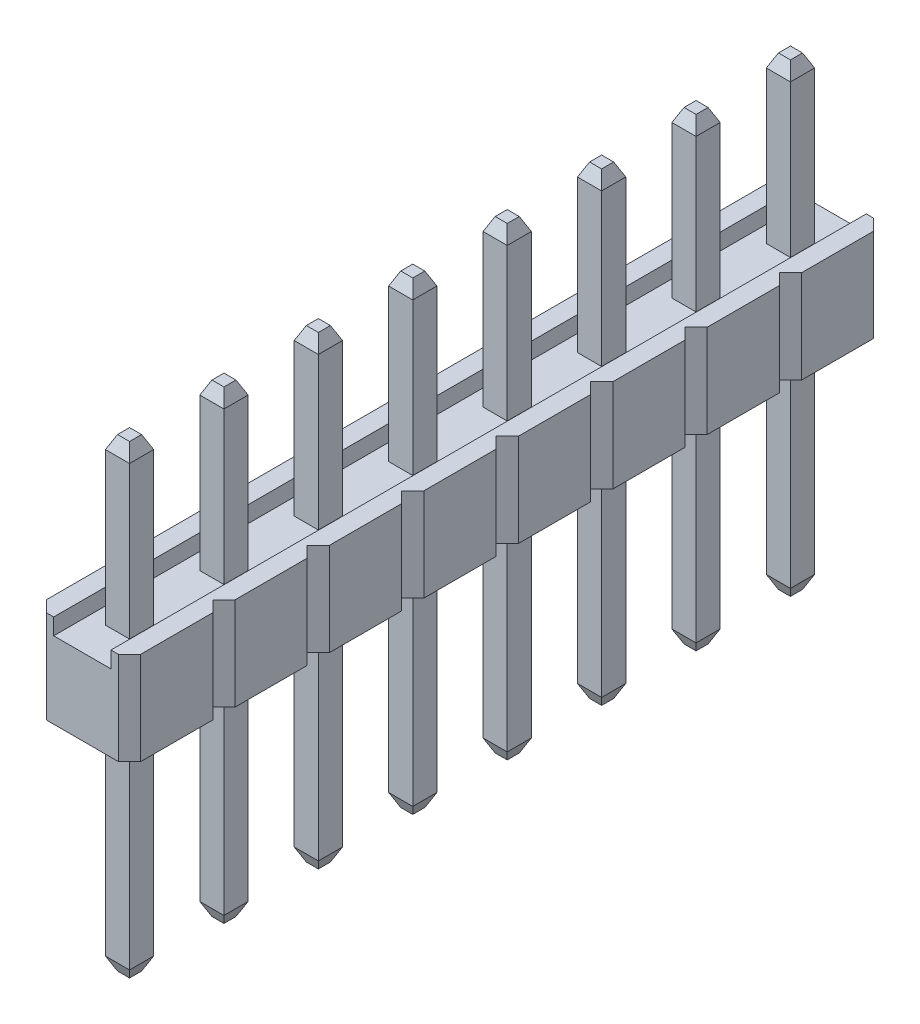
from build123d import *
from OCP.BRepFilletAPI import BRepFilletAPI_MakeChamfer

# Parameters (mm, degrees)
EXTRUDE1_DEPTH                   = 2.5
SKETCH2_W                        = 1.54
SKETCH2_H                        = 0.508742985
CUT_EXTRUDE1_DEPTH               = 12.5
SKETCH3_W                        = 0.65
SKETCH3_H                        = 0.65
EXTRUDE2_DEPTH                   = 4.44
CHAMFER1_SIZE                    = 0.35
CHAMFER1_SIZE2                   = 0.16320768
SKETCH4_W                        = 0.65
SKETCH4_H                        = 0.65
EXTRUDE3_DEPTH                   = 6
CHAMFER2_SIZE                    = 0.35
CHAMFER2_SIZE2                   = 0.16320768
PADR_O_LINEAR1_DEPTH             = 2.06
PADR_O_START                     = 2.06
PADR_O_LINEAR1_2_DEPTH           = 0.44
PADR_O_LINEAR2_COUNT             = 8
PADR_O_LINEAR2_PITCH             = 2.54
CHAMFER1_OF_PADR_O_LINEAR2_SIZE  = 0.35
CHAMFER1_OF_PADR_O_LINEAR2_SIZE2 = 0.16320768
CHAMFER2_OF_PADR_O_LINEAR2_SIZE  = 0.35
CHAMFER2_OF_PADR_O_LINEAR2_SIZE2 = 0.16320768


# Read off the part's stored shape, not the designer's step: Padrão linear1
with BuildPart() as part:
    # Sketch1 → Extrude1 (new body)
    with BuildSketch(Plane(origin=(0, 0, 0), x_dir=(1, 0, 0), z_dir=(0, 1, 0))):
        Polygon((-0.97, 1.27), (0.97, 1.27), (1.27, 0.97), (1.27, -0.97), (0.97, -1.27), (-0.97, -1.27), (-1.27, -0.97), (-1.27, 0.97), align=None)
    extrude(amount=EXTRUDE1_DEPTH)

    # Sketch2 → Cut-Extrude1 (cut)
    with BuildSketch(Plane.XY.offset(1.27)):
        with Locations((0, 2.314371493)):
            Rectangle(SKETCH2_W, SKETCH2_H)
    extrude(amount=-CUT_EXTRUDE1_DEPTH, mode=Mode.SUBTRACT)

    # Sketch3 → Extrude2 (add)
    with BuildSketch(Plane(origin=(0, 2.06, 0), x_dir=(-1, 0, 0), z_dir=(0, 1, 0))):
        Rectangle(SKETCH3_W, SKETCH3_H)
    extrude2 = extrude(amount=EXTRUDE2_DEPTH)

    # Chamfer1: one chamfer whose edges measure the first distance from different faces: ONE call of the kernel's chamfer builder (chamfer() names one face for all edges)
    chamfer1_edges_1 = [part.edges().sort_by_distance(p)[0] for p in [
        (-0.325, 6.5, 0),
    ]]
    chamfer1_side_1 = [part.faces().sort_by_distance(p)[0] for p in [
        (-0.325, 4.28, 0),
    ]]
    chamfer1_edges_2 = [part.edges().sort_by_distance(p)[0] for p in [
        (0, 6.5, 0.325),
    ]]
    chamfer1_side_2 = [part.faces().sort_by_distance(p)[0] for p in [
        (0, 4.28, 0.325),
    ]]
    chamfer1_edges_3 = [part.edges().sort_by_distance(p)[0] for p in [
        (0.325, 6.5, 0),
    ]]
    chamfer1_side_3 = [part.faces().sort_by_distance(p)[0] for p in [
        (0.325, 4.28, 0),
    ]]
    chamfer1_edges_4 = [part.edges().sort_by_distance(p)[0] for p in [
        (0, 6.5, -0.325),
    ]]
    chamfer1_side_4 = [part.faces().sort_by_distance(p)[0] for p in [
        (0, 4.28, -0.325),
    ]]
    chamfer1 = BRepFilletAPI_MakeChamfer(part.part.solid().wrapped)
    for e in chamfer1_edges_1:
        chamfer1.Add(CHAMFER1_SIZE, CHAMFER1_SIZE2, e.wrapped, chamfer1_side_1[0].wrapped)  # the first distance lies on this face
    for e in chamfer1_edges_2:
        chamfer1.Add(CHAMFER1_SIZE, CHAMFER1_SIZE2, e.wrapped, chamfer1_side_2[0].wrapped)  # the first distance lies on this face
    for e in chamfer1_edges_3:
        chamfer1.Add(CHAMFER1_SIZE, CHAMFER1_SIZE2, e.wrapped, chamfer1_side_3[0].wrapped)  # the first distance lies on this face
    for e in chamfer1_edges_4:
        chamfer1.Add(CHAMFER1_SIZE, CHAMFER1_SIZE2, e.wrapped, chamfer1_side_4[0].wrapped)  # the first distance lies on this face
    add(Compound.cast(chamfer1.Shape()), mode=Mode.REPLACE)

    # Sketch4 → Extrude3 (add)
    with BuildSketch(Plane.XZ):
        Rectangle(SKETCH4_W, SKETCH4_H)
    extrude3 = extrude(amount=EXTRUDE3_DEPTH)

    # Chamfer2: one chamfer whose edges measure the first distance from different faces: ONE call of the kernel's chamfer builder (chamfer() names one face for all edges)
    chamfer2_edges_1 = [part.edges().sort_by_distance(p)[0] for p in [
        (-0.325, -6, 0),
    ]]
    chamfer2_side_1 = [part.faces().sort_by_distance(p)[0] for p in [
        (-0.325, -3, 0),
    ]]
    chamfer2_edges_2 = [part.edges().sort_by_distance(p)[0] for p in [
        (0, -6, -0.325),
    ]]
    chamfer2_side_2 = [part.faces().sort_by_distance(p)[0] for p in [
        (0, -3, -0.325),
    ]]
    chamfer2_edges_3 = [part.edges().sort_by_distance(p)[0] for p in [
        (0.325, -6, 0),
    ]]
    chamfer2_side_3 = [part.faces().sort_by_distance(p)[0] for p in [
        (0.325, -3, 0),
    ]]
    chamfer2_edges_4 = [part.edges().sort_by_distance(p)[0] for p in [
        (0, -6, 0.325),
    ]]
    chamfer2_side_4 = [part.faces().sort_by_distance(p)[0] for p in [
        (0, -3, 0.325),
    ]]
    chamfer2 = BRepFilletAPI_MakeChamfer(part.part.solid().wrapped)
    for e in chamfer2_edges_1:
        chamfer2.Add(CHAMFER2_SIZE, CHAMFER2_SIZE2, e.wrapped, chamfer2_side_1[0].wrapped)  # the first distance lies on this face
    for e in chamfer2_edges_2:
        chamfer2.Add(CHAMFER2_SIZE, CHAMFER2_SIZE2, e.wrapped, chamfer2_side_2[0].wrapped)  # the first distance lies on this face
    for e in chamfer2_edges_3:
        chamfer2.Add(CHAMFER2_SIZE, CHAMFER2_SIZE2, e.wrapped, chamfer2_side_3[0].wrapped)  # the first distance lies on this face
    for e in chamfer2_edges_4:
        chamfer2.Add(CHAMFER2_SIZE, CHAMFER2_SIZE2, e.wrapped, chamfer2_side_4[0].wrapped)  # the first distance lies on this face
    add(Compound.cast(chamfer2.Shape()), mode=Mode.REPLACE)

    # Padrão linear1 outline → Padrão linear1 (add)
    with BuildSketch(Plane(origin=(0, 0, 0), x_dir=(1, 0, 0), z_dir=(0, 1, 0))):
        Polygon((-1.27, 3.51), (-1.27, 1.57), (-0.97, 1.27), (0.97, 1.27), (1.27, 1.57), (1.27, 3.51), (0.97, 3.81), (1.27, 4.11), (1.27, 6.05), (0.97, 6.35), (1.27, 6.65), (1.27, 8.59), (0.97, 8.89), (1.27, 9.19), (1.27, 11.13), (0.97, 11.43), (1.27, 11.73), (1.27, 13.67), (0.97, 13.97), (1.27, 14.27), (1.27, 16.21), (0.97, 16.51), (1.27, 16.81), (1.27, 18.75), (0.97, 19.05), (-0.97, 19.05), (-1.27, 18.75), (-1.27, 16.81), (-0.97, 16.51), (-1.27, 16.21), (-1.27, 14.27), (-0.97, 13.97), (-1.27, 13.67), (-1.27, 11.73), (-0.97, 11.43), (-1.27, 11.13), (-1.27, 9.19), (-0.97, 8.89), (-1.27, 8.59), (-1.27, 6.65), (-0.97, 6.35), (-1.27, 6.05), (-1.27, 4.11), (-0.97, 3.81), align=None)
    extrude(amount=PADR_O_LINEAR1_DEPTH)

    # Padr_o linear1 2 outline → Padr_o linear1 2 (add)
    with BuildSketch(Plane(origin=(0, 0, 0), x_dir=(1, 0, 0), z_dir=(0, 1, 0)).offset(PADR_O_START)):
        Polygon((-1.27, 3.51), (-1.27, 1.57), (-0.97, 1.27), (-0.77, 1.27), (-0.77, 19.05), (-0.97, 19.05), (-1.27, 18.75), (-1.27, 16.81), (-0.97, 16.51), (-1.27, 16.21), (-1.27, 14.27), (-0.97, 13.97), (-1.27, 13.67), (-1.27, 11.73), (-0.97, 11.43), (-1.27, 11.13), (-1.27, 9.19), (-0.97, 8.89), (-1.27, 8.59), (-1.27, 6.65), (-0.97, 6.35), (-1.27, 6.05), (-1.27, 4.11), (-0.97, 3.81), align=None)
        Polygon((0.77, 19.05), (0.77, 1.27), (0.97, 1.27), (1.27, 1.57), (1.27, 3.51), (0.97, 3.81), (1.27, 4.11), (1.27, 6.05), (0.97, 6.35), (1.27, 6.65), (1.27, 8.59), (0.97, 8.89), (1.27, 9.19), (1.27, 11.13), (0.97, 11.43), (1.27, 11.73), (1.27, 13.67), (0.97, 13.97), (1.27, 14.27), (1.27, 16.21), (0.97, 16.51), (1.27, 16.81), (1.27, 18.75), (0.97, 19.05), align=None)
    extrude(amount=PADR_O_LINEAR1_2_DEPTH)

    # Padrão linear2: Extrude2, Extrude3 ×8
    with Locations(*[(0, 0, -i * PADR_O_LINEAR2_PITCH) for i in range(1, PADR_O_LINEAR2_COUNT)]):
        add(extrude2)
        add(extrude3)

    # Chamfer1 of Padrão linear2: one chamfer whose edges measure the first distance from different faces: ONE call of the kernel's chamfer builder (chamfer() names one face for all edges)
    chamfer1_of_padr_o_linear2_edges_1 = [part.edges().sort_by_distance(p)[0] for p in [
        (-0.325, 6.5, -2.54),
    ]]
    chamfer1_of_padr_o_linear2_side_1 = [part.faces().sort_by_distance(p)[0] for p in [
        (-0.325, 4.28, -2.54),
    ]]
    chamfer1_of_padr_o_linear2_edges_2 = [part.edges().sort_by_distance(p)[0] for p in [
        (0, 6.5, -2.215),
    ]]
    chamfer1_of_padr_o_linear2_side_2 = [part.faces().sort_by_distance(p)[0] for p in [
        (0, 4.28, -2.215),
    ]]
    chamfer1_of_padr_o_linear2_edges_3 = [part.edges().sort_by_distance(p)[0] for p in [
        (0.325, 6.5, -2.54),
    ]]
    chamfer1_of_padr_o_linear2_side_3 = [part.faces().sort_by_distance(p)[0] for p in [
        (0.325, 4.28, -2.54),
    ]]
    chamfer1_of_padr_o_linear2_edges_4 = [part.edges().sort_by_distance(p)[0] for p in [
        (0, 6.5, -2.865),
    ]]
    chamfer1_of_padr_o_linear2_side_4 = [part.faces().sort_by_distance(p)[0] for p in [
        (0, 4.28, -2.865),
    ]]
    chamfer1_of_padr_o_linear2_edges_5 = [part.edges().sort_by_distance(p)[0] for p in [
        (-0.325, 6.5, -5.08),
    ]]
    chamfer1_of_padr_o_linear2_side_5 = [part.faces().sort_by_distance(p)[0] for p in [
        (-0.325, 4.28, -5.08),
    ]]
    chamfer1_of_padr_o_linear2_edges_6 = [part.edges().sort_by_distance(p)[0] for p in [
        (0, 6.5, -4.755),
    ]]
    chamfer1_of_padr_o_linear2_side_6 = [part.faces().sort_by_distance(p)[0] for p in [
        (0, 4.28, -4.755),
    ]]
    chamfer1_of_padr_o_linear2_edges_7 = [part.edges().sort_by_distance(p)[0] for p in [
        (0.325, 6.5, -5.08),
    ]]
    chamfer1_of_padr_o_linear2_side_7 = [part.faces().sort_by_distance(p)[0] for p in [
        (0.325, 4.28, -5.08),
    ]]
    chamfer1_of_padr_o_linear2_edges_8 = [part.edges().sort_by_distance(p)[0] for p in [
        (0, 6.5, -5.405),
    ]]
    chamfer1_of_padr_o_linear2_side_8 = [part.faces().sort_by_distance(p)[0] for p in [
        (0, 4.28, -5.405),
    ]]
    chamfer1_of_padr_o_linear2_edges_9 = [part.edges().sort_by_distance(p)[0] for p in [
        (-0.325, 6.5, -7.62),
    ]]
    chamfer1_of_padr_o_linear2_side_9 = [part.faces().sort_by_distance(p)[0] for p in [
        (-0.325, 4.28, -7.62),
    ]]
    chamfer1_of_padr_o_linear2_edges_10 = [part.edges().sort_by_distance(p)[0] for p in [
        (0, 6.5, -7.295),
    ]]
    chamfer1_of_padr_o_linear2_side_10 = [part.faces().sort_by_distance(p)[0] for p in [
        (0, 4.28, -7.295),
    ]]
    chamfer1_of_padr_o_linear2_edges_11 = [part.edges().sort_by_distance(p)[0] for p in [
        (0.325, 6.5, -7.62),
    ]]
    chamfer1_of_padr_o_linear2_side_11 = [part.faces().sort_by_distance(p)[0] for p in [
        (0.325, 4.28, -7.62),
    ]]
    chamfer1_of_padr_o_linear2_edges_12 = [part.edges().sort_by_distance(p)[0] for p in [
        (0, 6.5, -7.945),
    ]]
    chamfer1_of_padr_o_linear2_side_12 = [part.faces().sort_by_distance(p)[0] for p in [
        (0, 4.28, -7.945),
    ]]
    chamfer1_of_padr_o_linear2_edges_13 = [part.edges().sort_by_distance(p)[0] for p in [
        (-0.325, 6.5, -10.16),
    ]]
    chamfer1_of_padr_o_linear2_side_13 = [part.faces().sort_by_distance(p)[0] for p in [
        (-0.325, 4.28, -10.16),
    ]]
    chamfer1_of_padr_o_linear2_edges_14 = [part.edges().sort_by_distance(p)[0] for p in [
        (0, 6.5, -9.835),
    ]]
    chamfer1_of_padr_o_linear2_side_14 = [part.faces().sort_by_distance(p)[0] for p in [
        (0, 4.28, -9.835),
    ]]
    chamfer1_of_padr_o_linear2_edges_15 = [part.edges().sort_by_distance(p)[0] for p in [
        (0.325, 6.5, -10.16),
    ]]
    chamfer1_of_padr_o_linear2_side_15 = [part.faces().sort_by_distance(p)[0] for p in [
        (0.325, 4.28, -10.16),
    ]]
    chamfer1_of_padr_o_linear2_edges_16 = [part.edges().sort_by_distance(p)[0] for p in [
        (0, 6.5, -10.485),
    ]]
    chamfer1_of_padr_o_linear2_side_16 = [part.faces().sort_by_distance(p)[0] for p in [
        (0, 4.28, -10.485),
    ]]
    chamfer1_of_padr_o_linear2_edges_17 = [part.edges().sort_by_distance(p)[0] for p in [
        (-0.325, 6.5, -12.7),
    ]]
    chamfer1_of_padr_o_linear2_side_17 = [part.faces().sort_by_distance(p)[0] for p in [
        (-0.325, 4.28, -12.7),
    ]]
    chamfer1_of_padr_o_linear2_edges_18 = [part.edges().sort_by_distance(p)[0] for p in [
        (0, 6.5, -12.375),
    ]]
    chamfer1_of_padr_o_linear2_side_18 = [part.faces().sort_by_distance(p)[0] for p in [
        (0, 4.28, -12.375),
    ]]
    chamfer1_of_padr_o_linear2_edges_19 = [part.edges().sort_by_distance(p)[0] for p in [
        (0.325, 6.5, -12.7),
    ]]
    chamfer1_of_padr_o_linear2_side_19 = [part.faces().sort_by_distance(p)[0] for p in [
        (0.325, 4.28, -12.7),
    ]]
    chamfer1_of_padr_o_linear2_edges_20 = [part.edges().sort_by_distance(p)[0] for p in [
        (0, 6.5, -13.025),
    ]]
    chamfer1_of_padr_o_linear2_side_20 = [part.faces().sort_by_distance(p)[0] for p in [
        (0, 4.28, -13.025),
    ]]
    chamfer1_of_padr_o_linear2_edges_21 = [part.edges().sort_by_distance(p)[0] for p in [
        (-0.325, 6.5, -15.24),
    ]]
    chamfer1_of_padr_o_linear2_side_21 = [part.faces().sort_by_distance(p)[0] for p in [
        (-0.325, 4.28, -15.24),
    ]]
    chamfer1_of_padr_o_linear2_edges_22 = [part.edges().sort_by_distance(p)[0] for p in [
        (0, 6.5, -14.915),
    ]]
    chamfer1_of_padr_o_linear2_side_22 = [part.faces().sort_by_distance(p)[0] for p in [
        (0, 4.28, -14.915),
    ]]
    chamfer1_of_padr_o_linear2_edges_23 = [part.edges().sort_by_distance(p)[0] for p in [
        (0.325, 6.5, -15.24),
    ]]
    chamfer1_of_padr_o_linear2_side_23 = [part.faces().sort_by_distance(p)[0] for p in [
        (0.325, 4.28, -15.24),
    ]]
    chamfer1_of_padr_o_linear2_edges_24 = [part.edges().sort_by_distance(p)[0] for p in [
        (0, 6.5, -15.565),
    ]]
    chamfer1_of_padr_o_linear2_side_24 = [part.faces().sort_by_distance(p)[0] for p in [
        (0, 4.28, -15.565),
    ]]
    chamfer1_of_padr_o_linear2_edges_25 = [part.edges().sort_by_distance(p)[0] for p in [
        (-0.325, 6.5, -17.78),
    ]]
    chamfer1_of_padr_o_linear2_side_25 = [part.faces().sort_by_distance(p)[0] for p in [
        (-0.325, 4.28, -17.78),
    ]]
    chamfer1_of_padr_o_linear2_edges_26 = [part.edges().sort_by_distance(p)[0] for p in [
        (0, 6.5, -17.455),
    ]]
    chamfer1_of_padr_o_linear2_side_26 = [part.faces().sort_by_distance(p)[0] for p in [
        (0, 4.28, -17.455),
    ]]
    chamfer1_of_padr_o_linear2_edges_27 = [part.edges().sort_by_distance(p)[0] for p in [
        (0.325, 6.5, -17.78),
    ]]
    chamfer1_of_padr_o_linear2_side_27 = [part.faces().sort_by_distance(p)[0] for p in [
        (0.325, 4.28, -17.78),
    ]]
    chamfer1_of_padr_o_linear2_edges_28 = [part.edges().sort_by_distance(p)[0] for p in [
        (0, 6.5, -18.105),
    ]]
    chamfer1_of_padr_o_linear2_side_28 = [part.faces().sort_by_distance(p)[0] for p in [
        (0, 4.28, -18.105),
    ]]
    chamfer1_of_padr_o_linear2 = BRepFilletAPI_MakeChamfer(part.part.solid().wrapped)
    for e in chamfer1_of_padr_o_linear2_edges_1:
        chamfer1_of_padr_o_linear2.Add(CHAMFER1_OF_PADR_O_LINEAR2_SIZE, CHAMFER1_OF_PADR_O_LINEAR2_SIZE2, e.wrapped, chamfer1_of_padr_o_linear2_side_1[0].wrapped)  # the first distance lies on this face
    for e in chamfer1_of_padr_o_linear2_edges_2:
        chamfer1_of_padr_o_linear2.Add(CHAMFER1_OF_PADR_O_LINEAR2_SIZE, CHAMFER1_OF_PADR_O_LINEAR2_SIZE2, e.wrapped, chamfer1_of_padr_o_linear2_side_2[0].wrapped)  # the first distance lies on this face
    for e in chamfer1_of_padr_o_linear2_edges_3:
        chamfer1_of_padr_o_linear2.Add(CHAMFER1_OF_PADR_O_LINEAR2_SIZE, CHAMFER1_OF_PADR_O_LINEAR2_SIZE2, e.wrapped, chamfer1_of_padr_o_linear2_side_3[0].wrapped)  # the first distance lies on this face
    for e in chamfer1_of_padr_o_linear2_edges_4:
        chamfer1_of_padr_o_linear2.Add(CHAMFER1_OF_PADR_O_LINEAR2_SIZE, CHAMFER1_OF_PADR_O_LINEAR2_SIZE2, e.wrapped, chamfer1_of_padr_o_linear2_side_4[0].wrapped)  # the first distance lies on this face
    for e in chamfer1_of_padr_o_linear2_edges_5:
        chamfer1_of_padr_o_linear2.Add(CHAMFER1_OF_PADR_O_LINEAR2_SIZE, CHAMFER1_OF_PADR_O_LINEAR2_SIZE2, e.wrapped, chamfer1_of_padr_o_linear2_side_5[0].wrapped)  # the first distance lies on this face
    for e in chamfer1_of_padr_o_linear2_edges_6:
        chamfer1_of_padr_o_linear2.Add(CHAMFER1_OF_PADR_O_LINEAR2_SIZE, CHAMFER1_OF_PADR_O_LINEAR2_SIZE2, e.wrapped, chamfer1_of_padr_o_linear2_side_6[0].wrapped)  # the first distance lies on this face
    for e in chamfer1_of_padr_o_linear2_edges_7:
        chamfer1_of_padr_o_linear2.Add(CHAMFER1_OF_PADR_O_LINEAR2_SIZE, CHAMFER1_OF_PADR_O_LINEAR2_SIZE2, e.wrapped, chamfer1_of_padr_o_linear2_side_7[0].wrapped)  # the first distance lies on this face
    for e in chamfer1_of_padr_o_linear2_edges_8:
        chamfer1_of_padr_o_linear2.Add(CHAMFER1_OF_PADR_O_LINEAR2_SIZE, CHAMFER1_OF_PADR_O_LINEAR2_SIZE2, e.wrapped, chamfer1_of_padr_o_linear2_side_8[0].wrapped)  # the first distance lies on this face
    for e in chamfer1_of_padr_o_linear2_edges_9:
        chamfer1_of_padr_o_linear2.Add(CHAMFER1_OF_PADR_O_LINEAR2_SIZE, CHAMFER1_OF_PADR_O_LINEAR2_SIZE2, e.wrapped, chamfer1_of_padr_o_linear2_side_9[0].wrapped)  # the first distance lies on this face
    for e in chamfer1_of_padr_o_linear2_edges_10:
        chamfer1_of_padr_o_linear2.Add(CHAMFER1_OF_PADR_O_LINEAR2_SIZE, CHAMFER1_OF_PADR_O_LINEAR2_SIZE2, e.wrapped, chamfer1_of_padr_o_linear2_side_10[0].wrapped)  # the first distance lies on this face
    for e in chamfer1_of_padr_o_linear2_edges_11:
        chamfer1_of_padr_o_linear2.Add(CHAMFER1_OF_PADR_O_LINEAR2_SIZE, CHAMFER1_OF_PADR_O_LINEAR2_SIZE2, e.wrapped, chamfer1_of_padr_o_linear2_side_11[0].wrapped)  # the first distance lies on this face
    for e in chamfer1_of_padr_o_linear2_edges_12:
        chamfer1_of_padr_o_linear2.Add(CHAMFER1_OF_PADR_O_LINEAR2_SIZE, CHAMFER1_OF_PADR_O_LINEAR2_SIZE2, e.wrapped, chamfer1_of_padr_o_linear2_side_12[0].wrapped)  # the first distance lies on this face
    for e in chamfer1_of_padr_o_linear2_edges_13:
        chamfer1_of_padr_o_linear2.Add(CHAMFER1_OF_PADR_O_LINEAR2_SIZE, CHAMFER1_OF_PADR_O_LINEAR2_SIZE2, e.wrapped, chamfer1_of_padr_o_linear2_side_13[0].wrapped)  # the first distance lies on this face
    for e in chamfer1_of_padr_o_linear2_edges_14:
        chamfer1_of_padr_o_linear2.Add(CHAMFER1_OF_PADR_O_LINEAR2_SIZE, CHAMFER1_OF_PADR_O_LINEAR2_SIZE2, e.wrapped, chamfer1_of_padr_o_linear2_side_14[0].wrapped)  # the first distance lies on this face
    for e in chamfer1_of_padr_o_linear2_edges_15:
        chamfer1_of_padr_o_linear2.Add(CHAMFER1_OF_PADR_O_LINEAR2_SIZE, CHAMFER1_OF_PADR_O_LINEAR2_SIZE2, e.wrapped, chamfer1_of_padr_o_linear2_side_15[0].wrapped)  # the first distance lies on this face
    for e in chamfer1_of_padr_o_linear2_edges_16:
        chamfer1_of_padr_o_linear2.Add(CHAMFER1_OF_PADR_O_LINEAR2_SIZE, CHAMFER1_OF_PADR_O_LINEAR2_SIZE2, e.wrapped, chamfer1_of_padr_o_linear2_side_16[0].wrapped)  # the first distance lies on this face
    for e in chamfer1_of_padr_o_linear2_edges_17:
        chamfer1_of_padr_o_linear2.Add(CHAMFER1_OF_PADR_O_LINEAR2_SIZE, CHAMFER1_OF_PADR_O_LINEAR2_SIZE2, e.wrapped, chamfer1_of_padr_o_linear2_side_17[0].wrapped)  # the first distance lies on this face
    for e in chamfer1_of_padr_o_linear2_edges_18:
        chamfer1_of_padr_o_linear2.Add(CHAMFER1_OF_PADR_O_LINEAR2_SIZE, CHAMFER1_OF_PADR_O_LINEAR2_SIZE2, e.wrapped, chamfer1_of_padr_o_linear2_side_18[0].wrapped)  # the first distance lies on this face
    for e in chamfer1_of_padr_o_linear2_edges_19:
        chamfer1_of_padr_o_linear2.Add(CHAMFER1_OF_PADR_O_LINEAR2_SIZE, CHAMFER1_OF_PADR_O_LINEAR2_SIZE2, e.wrapped, chamfer1_of_padr_o_linear2_side_19[0].wrapped)  # the first distance lies on this face
    for e in chamfer1_of_padr_o_linear2_edges_20:
        chamfer1_of_padr_o_linear2.Add(CHAMFER1_OF_PADR_O_LINEAR2_SIZE, CHAMFER1_OF_PADR_O_LINEAR2_SIZE2, e.wrapped, chamfer1_of_padr_o_linear2_side_20[0].wrapped)  # the first distance lies on this face
    for e in chamfer1_of_padr_o_linear2_edges_21:
        chamfer1_of_padr_o_linear2.Add(CHAMFER1_OF_PADR_O_LINEAR2_SIZE, CHAMFER1_OF_PADR_O_LINEAR2_SIZE2, e.wrapped, chamfer1_of_padr_o_linear2_side_21[0].wrapped)  # the first distance lies on this face
    for e in chamfer1_of_padr_o_linear2_edges_22:
        chamfer1_of_padr_o_linear2.Add(CHAMFER1_OF_PADR_O_LINEAR2_SIZE, CHAMFER1_OF_PADR_O_LINEAR2_SIZE2, e.wrapped, chamfer1_of_padr_o_linear2_side_22[0].wrapped)  # the first distance lies on this face
    for e in chamfer1_of_padr_o_linear2_edges_23:
        chamfer1_of_padr_o_linear2.Add(CHAMFER1_OF_PADR_O_LINEAR2_SIZE, CHAMFER1_OF_PADR_O_LINEAR2_SIZE2, e.wrapped, chamfer1_of_padr_o_linear2_side_23[0].wrapped)  # the first distance lies on this face
    for e in chamfer1_of_padr_o_linear2_edges_24:
        chamfer1_of_padr_o_linear2.Add(CHAMFER1_OF_PADR_O_LINEAR2_SIZE, CHAMFER1_OF_PADR_O_LINEAR2_SIZE2, e.wrapped, chamfer1_of_padr_o_linear2_side_24[0].wrapped)  # the first distance lies on this face
    for e in chamfer1_of_padr_o_linear2_edges_25:
        chamfer1_of_padr_o_linear2.Add(CHAMFER1_OF_PADR_O_LINEAR2_SIZE, CHAMFER1_OF_PADR_O_LINEAR2_SIZE2, e.wrapped, chamfer1_of_padr_o_linear2_side_25[0].wrapped)  # the first distance lies on this face
    for e in chamfer1_of_padr_o_linear2_edges_26:
        chamfer1_of_padr_o_linear2.Add(CHAMFER1_OF_PADR_O_LINEAR2_SIZE, CHAMFER1_OF_PADR_O_LINEAR2_SIZE2, e.wrapped, chamfer1_of_padr_o_linear2_side_26[0].wrapped)  # the first distance lies on this face
    for e in chamfer1_of_padr_o_linear2_edges_27:
        chamfer1_of_padr_o_linear2.Add(CHAMFER1_OF_PADR_O_LINEAR2_SIZE, CHAMFER1_OF_PADR_O_LINEAR2_SIZE2, e.wrapped, chamfer1_of_padr_o_linear2_side_27[0].wrapped)  # the first distance lies on this face
    for e in chamfer1_of_padr_o_linear2_edges_28:
        chamfer1_of_padr_o_linear2.Add(CHAMFER1_OF_PADR_O_LINEAR2_SIZE, CHAMFER1_OF_PADR_O_LINEAR2_SIZE2, e.wrapped, chamfer1_of_padr_o_linear2_side_28[0].wrapped)  # the first distance lies on this face
    add(Compound.cast(chamfer1_of_padr_o_linear2.Shape()), mode=Mode.REPLACE)

    # Chamfer2 of Padrão linear2: one chamfer whose edges measure the first distance from different faces: ONE call of the kernel's chamfer builder (chamfer() names one face for all edges)
    chamfer2_of_padr_o_linear2_edges_1 = [part.edges().sort_by_distance(p)[0] for p in [
        (-0.325, -6, -2.54),
    ]]
    chamfer2_of_padr_o_linear2_side_1 = [part.faces().sort_by_distance(p)[0] for p in [
        (-0.325, -3, -2.54),
    ]]
    chamfer2_of_padr_o_linear2_edges_2 = [part.edges().sort_by_distance(p)[0] for p in [
        (0, -6, -2.865),
    ]]
    chamfer2_of_padr_o_linear2_side_2 = [part.faces().sort_by_distance(p)[0] for p in [
        (0, -3, -2.865),
    ]]
    chamfer2_of_padr_o_linear2_edges_3 = [part.edges().sort_by_distance(p)[0] for p in [
        (0.325, -6, -2.54),
    ]]
    chamfer2_of_padr_o_linear2_side_3 = [part.faces().sort_by_distance(p)[0] for p in [
        (0.325, -3, -2.54),
    ]]
    chamfer2_of_padr_o_linear2_edges_4 = [part.edges().sort_by_distance(p)[0] for p in [
        (0, -6, -2.215),
    ]]
    chamfer2_of_padr_o_linear2_side_4 = [part.faces().sort_by_distance(p)[0] for p in [
        (0, -3, -2.215),
    ]]
    chamfer2_of_padr_o_linear2_edges_5 = [part.edges().sort_by_distance(p)[0] for p in [
        (-0.325, -6, -5.08),
    ]]
    chamfer2_of_padr_o_linear2_side_5 = [part.faces().sort_by_distance(p)[0] for p in [
        (-0.325, -3, -5.08),
    ]]
    chamfer2_of_padr_o_linear2_edges_6 = [part.edges().sort_by_distance(p)[0] for p in [
        (0, -6, -5.405),
    ]]
    chamfer2_of_padr_o_linear2_side_6 = [part.faces().sort_by_distance(p)[0] for p in [
        (0, -3, -5.405),
    ]]
    chamfer2_of_padr_o_linear2_edges_7 = [part.edges().sort_by_distance(p)[0] for p in [
        (0.325, -6, -5.08),
    ]]
    chamfer2_of_padr_o_linear2_side_7 = [part.faces().sort_by_distance(p)[0] for p in [
        (0.325, -3, -5.08),
    ]]
    chamfer2_of_padr_o_linear2_edges_8 = [part.edges().sort_by_distance(p)[0] for p in [
        (0, -6, -4.755),
    ]]
    chamfer2_of_padr_o_linear2_side_8 = [part.faces().sort_by_distance(p)[0] for p in [
        (0, -3, -4.755),
    ]]
    chamfer2_of_padr_o_linear2_edges_9 = [part.edges().sort_by_distance(p)[0] for p in [
        (-0.325, -6, -7.62),
    ]]
    chamfer2_of_padr_o_linear2_side_9 = [part.faces().sort_by_distance(p)[0] for p in [
        (-0.325, -3, -7.62),
    ]]
    chamfer2_of_padr_o_linear2_edges_10 = [part.edges().sort_by_distance(p)[0] for p in [
        (0, -6, -7.945),
    ]]
    chamfer2_of_padr_o_linear2_side_10 = [part.faces().sort_by_distance(p)[0] for p in [
        (0, -3, -7.945),
    ]]
    chamfer2_of_padr_o_linear2_edges_11 = [part.edges().sort_by_distance(p)[0] for p in [
        (0.325, -6, -7.62),
    ]]
    chamfer2_of_padr_o_linear2_side_11 = [part.faces().sort_by_distance(p)[0] for p in [
        (0.325, -3, -7.62),
    ]]
    chamfer2_of_padr_o_linear2_edges_12 = [part.edges().sort_by_distance(p)[0] for p in [
        (0, -6, -7.295),
    ]]
    chamfer2_of_padr_o_linear2_side_12 = [part.faces().sort_by_distance(p)[0] for p in [
        (0, -3, -7.295),
    ]]
    chamfer2_of_padr_o_linear2_edges_13 = [part.edges().sort_by_distance(p)[0] for p in [
        (-0.325, -6, -10.16),
    ]]
    chamfer2_of_padr_o_linear2_side_13 = [part.faces().sort_by_distance(p)[0] for p in [
        (-0.325, -3, -10.16),
    ]]
    chamfer2_of_padr_o_linear2_edges_14 = [part.edges().sort_by_distance(p)[0] for p in [
        (0, -6, -10.485),
    ]]
    chamfer2_of_padr_o_linear2_side_14 = [part.faces().sort_by_distance(p)[0] for p in [
        (0, -3, -10.485),
    ]]
    chamfer2_of_padr_o_linear2_edges_15 = [part.edges().sort_by_distance(p)[0] for p in [
        (0.325, -6, -10.16),
    ]]
    chamfer2_of_padr_o_linear2_side_15 = [part.faces().sort_by_distance(p)[0] for p in [
        (0.325, -3, -10.16),
    ]]
    chamfer2_of_padr_o_linear2_edges_16 = [part.edges().sort_by_distance(p)[0] for p in [
        (0, -6, -9.835),
    ]]
    chamfer2_of_padr_o_linear2_side_16 = [part.faces().sort_by_distance(p)[0] for p in [
        (0, -3, -9.835),
    ]]
    chamfer2_of_padr_o_linear2_edges_17 = [part.edges().sort_by_distance(p)[0] for p in [
        (-0.325, -6, -12.7),
    ]]
    chamfer2_of_padr_o_linear2_side_17 = [part.faces().sort_by_distance(p)[0] for p in [
        (-0.325, -3, -12.7),
    ]]
    chamfer2_of_padr_o_linear2_edges_18 = [part.edges().sort_by_distance(p)[0] for p in [
        (0, -6, -13.025),
    ]]
    chamfer2_of_padr_o_linear2_side_18 = [part.faces().sort_by_distance(p)[0] for p in [
        (0, -3, -13.025),
    ]]
    chamfer2_of_padr_o_linear2_edges_19 = [part.edges().sort_by_distance(p)[0] for p in [
        (0.325, -6, -12.7),
    ]]
    chamfer2_of_padr_o_linear2_side_19 = [part.faces().sort_by_distance(p)[0] for p in [
        (0.325, -3, -12.7),
    ]]
    chamfer2_of_padr_o_linear2_edges_20 = [part.edges().sort_by_distance(p)[0] for p in [
        (0, -6, -12.375),
    ]]
    chamfer2_of_padr_o_linear2_side_20 = [part.faces().sort_by_distance(p)[0] for p in [
        (0, -3, -12.375),
    ]]
    chamfer2_of_padr_o_linear2_edges_21 = [part.edges().sort_by_distance(p)[0] for p in [
        (-0.325, -6, -15.24),
    ]]
    chamfer2_of_padr_o_linear2_side_21 = [part.faces().sort_by_distance(p)[0] for p in [
        (-0.325, -3, -15.24),
    ]]
    chamfer2_of_padr_o_linear2_edges_22 = [part.edges().sort_by_distance(p)[0] for p in [
        (0, -6, -15.565),
    ]]
    chamfer2_of_padr_o_linear2_side_22 = [part.faces().sort_by_distance(p)[0] for p in [
        (0, -3, -15.565),
    ]]
    chamfer2_of_padr_o_linear2_edges_23 = [part.edges().sort_by_distance(p)[0] for p in [
        (0.325, -6, -15.24),
    ]]
    chamfer2_of_padr_o_linear2_side_23 = [part.faces().sort_by_distance(p)[0] for p in [
        (0.325, -3, -15.24),
    ]]
    chamfer2_of_padr_o_linear2_edges_24 = [part.edges().sort_by_distance(p)[0] for p in [
        (0, -6, -14.915),
    ]]
    chamfer2_of_padr_o_linear2_side_24 = [part.faces().sort_by_distance(p)[0] for p in [
        (0, -3, -14.915),
    ]]
    chamfer2_of_padr_o_linear2_edges_25 = [part.edges().sort_by_distance(p)[0] for p in [
        (-0.325, -6, -17.78),
    ]]
    chamfer2_of_padr_o_linear2_side_25 = [part.faces().sort_by_distance(p)[0] for p in [
        (-0.325, -3, -17.78),
    ]]
    chamfer2_of_padr_o_linear2_edges_26 = [part.edges().sort_by_distance(p)[0] for p in [
        (0, -6, -18.105),
    ]]
    chamfer2_of_padr_o_linear2_side_26 = [part.faces().sort_by_distance(p)[0] for p in [
        (0, -3, -18.105),
    ]]
    chamfer2_of_padr_o_linear2_edges_27 = [part.edges().sort_by_distance(p)[0] for p in [
        (0.325, -6, -17.78),
    ]]
    chamfer2_of_padr_o_linear2_side_27 = [part.faces().sort_by_distance(p)[0] for p in [
        (0.325, -3, -17.78),
    ]]
    chamfer2_of_padr_o_linear2_edges_28 = [part.edges().sort_by_distance(p)[0] for p in [
        (0, -6, -17.455),
    ]]
    chamfer2_of_padr_o_linear2_side_28 = [part.faces().sort_by_distance(p)[0] for p in [
        (0, -3, -17.455),
    ]]
    chamfer2_of_padr_o_linear2 = BRepFilletAPI_MakeChamfer(part.part.solid().wrapped)
    for e in chamfer2_of_padr_o_linear2_edges_1:
        chamfer2_of_padr_o_linear2.Add(CHAMFER2_OF_PADR_O_LINEAR2_SIZE, CHAMFER2_OF_PADR_O_LINEAR2_SIZE2, e.wrapped, chamfer2_of_padr_o_linear2_side_1[0].wrapped)  # the first distance lies on this face
    for e in chamfer2_of_padr_o_linear2_edges_2:
        chamfer2_of_padr_o_linear2.Add(CHAMFER2_OF_PADR_O_LINEAR2_SIZE, CHAMFER2_OF_PADR_O_LINEAR2_SIZE2, e.wrapped, chamfer2_of_padr_o_linear2_side_2[0].wrapped)  # the first distance lies on this face
    for e in chamfer2_of_padr_o_linear2_edges_3:
        chamfer2_of_padr_o_linear2.Add(CHAMFER2_OF_PADR_O_LINEAR2_SIZE, CHAMFER2_OF_PADR_O_LINEAR2_SIZE2, e.wrapped, chamfer2_of_padr_o_linear2_side_3[0].wrapped)  # the first distance lies on this face
    for e in chamfer2_of_padr_o_linear2_edges_4:
        chamfer2_of_padr_o_linear2.Add(CHAMFER2_OF_PADR_O_LINEAR2_SIZE, CHAMFER2_OF_PADR_O_LINEAR2_SIZE2, e.wrapped, chamfer2_of_padr_o_linear2_side_4[0].wrapped)  # the first distance lies on this face
    for e in chamfer2_of_padr_o_linear2_edges_5:
        chamfer2_of_padr_o_linear2.Add(CHAMFER2_OF_PADR_O_LINEAR2_SIZE, CHAMFER2_OF_PADR_O_LINEAR2_SIZE2, e.wrapped, chamfer2_of_padr_o_linear2_side_5[0].wrapped)  # the first distance lies on this face
    for e in chamfer2_of_padr_o_linear2_edges_6:
        chamfer2_of_padr_o_linear2.Add(CHAMFER2_OF_PADR_O_LINEAR2_SIZE, CHAMFER2_OF_PADR_O_LINEAR2_SIZE2, e.wrapped, chamfer2_of_padr_o_linear2_side_6[0].wrapped)  # the first distance lies on this face
    for e in chamfer2_of_padr_o_linear2_edges_7:
        chamfer2_of_padr_o_linear2.Add(CHAMFER2_OF_PADR_O_LINEAR2_SIZE, CHAMFER2_OF_PADR_O_LINEAR2_SIZE2, e.wrapped, chamfer2_of_padr_o_linear2_side_7[0].wrapped)  # the first distance lies on this face
    for e in chamfer2_of_padr_o_linear2_edges_8:
        chamfer2_of_padr_o_linear2.Add(CHAMFER2_OF_PADR_O_LINEAR2_SIZE, CHAMFER2_OF_PADR_O_LINEAR2_SIZE2, e.wrapped, chamfer2_of_padr_o_linear2_side_8[0].wrapped)  # the first distance lies on this face
    for e in chamfer2_of_padr_o_linear2_edges_9:
        chamfer2_of_padr_o_linear2.Add(CHAMFER2_OF_PADR_O_LINEAR2_SIZE, CHAMFER2_OF_PADR_O_LINEAR2_SIZE2, e.wrapped, chamfer2_of_padr_o_linear2_side_9[0].wrapped)  # the first distance lies on this face
    for e in chamfer2_of_padr_o_linear2_edges_10:
        chamfer2_of_padr_o_linear2.Add(CHAMFER2_OF_PADR_O_LINEAR2_SIZE, CHAMFER2_OF_PADR_O_LINEAR2_SIZE2, e.wrapped, chamfer2_of_padr_o_linear2_side_10[0].wrapped)  # the first distance lies on this face
    for e in chamfer2_of_padr_o_linear2_edges_11:
        chamfer2_of_padr_o_linear2.Add(CHAMFER2_OF_PADR_O_LINEAR2_SIZE, CHAMFER2_OF_PADR_O_LINEAR2_SIZE2, e.wrapped, chamfer2_of_padr_o_linear2_side_11[0].wrapped)  # the first distance lies on this face
    for e in chamfer2_of_padr_o_linear2_edges_12:
        chamfer2_of_padr_o_linear2.Add(CHAMFER2_OF_PADR_O_LINEAR2_SIZE, CHAMFER2_OF_PADR_O_LINEAR2_SIZE2, e.wrapped, chamfer2_of_padr_o_linear2_side_12[0].wrapped)  # the first distance lies on this face
    for e in chamfer2_of_padr_o_linear2_edges_13:
        chamfer2_of_padr_o_linear2.Add(CHAMFER2_OF_PADR_O_LINEAR2_SIZE, CHAMFER2_OF_PADR_O_LINEAR2_SIZE2, e.wrapped, chamfer2_of_padr_o_linear2_side_13[0].wrapped)  # the first distance lies on this face
    for e in chamfer2_of_padr_o_linear2_edges_14:
        chamfer2_of_padr_o_linear2.Add(CHAMFER2_OF_PADR_O_LINEAR2_SIZE, CHAMFER2_OF_PADR_O_LINEAR2_SIZE2, e.wrapped, chamfer2_of_padr_o_linear2_side_14[0].wrapped)  # the first distance lies on this face
    for e in chamfer2_of_padr_o_linear2_edges_15:
        chamfer2_of_padr_o_linear2.Add(CHAMFER2_OF_PADR_O_LINEAR2_SIZE, CHAMFER2_OF_PADR_O_LINEAR2_SIZE2, e.wrapped, chamfer2_of_padr_o_linear2_side_15[0].wrapped)  # the first distance lies on this face
    for e in chamfer2_of_padr_o_linear2_edges_16:
        chamfer2_of_padr_o_linear2.Add(CHAMFER2_OF_PADR_O_LINEAR2_SIZE, CHAMFER2_OF_PADR_O_LINEAR2_SIZE2, e.wrapped, chamfer2_of_padr_o_linear2_side_16[0].wrapped)  # the first distance lies on this face
    for e in chamfer2_of_padr_o_linear2_edges_17:
        chamfer2_of_padr_o_linear2.Add(CHAMFER2_OF_PADR_O_LINEAR2_SIZE, CHAMFER2_OF_PADR_O_LINEAR2_SIZE2, e.wrapped, chamfer2_of_padr_o_linear2_side_17[0].wrapped)  # the first distance lies on this face
    for e in chamfer2_of_padr_o_linear2_edges_18:
        chamfer2_of_padr_o_linear2.Add(CHAMFER2_OF_PADR_O_LINEAR2_SIZE, CHAMFER2_OF_PADR_O_LINEAR2_SIZE2, e.wrapped, chamfer2_of_padr_o_linear2_side_18[0].wrapped)  # the first distance lies on this face
    for e in chamfer2_of_padr_o_linear2_edges_19:
        chamfer2_of_padr_o_linear2.Add(CHAMFER2_OF_PADR_O_LINEAR2_SIZE, CHAMFER2_OF_PADR_O_LINEAR2_SIZE2, e.wrapped, chamfer2_of_padr_o_linear2_side_19[0].wrapped)  # the first distance lies on this face
    for e in chamfer2_of_padr_o_linear2_edges_20:
        chamfer2_of_padr_o_linear2.Add(CHAMFER2_OF_PADR_O_LINEAR2_SIZE, CHAMFER2_OF_PADR_O_LINEAR2_SIZE2, e.wrapped, chamfer2_of_padr_o_linear2_side_20[0].wrapped)  # the first distance lies on this face
    for e in chamfer2_of_padr_o_linear2_edges_21:
        chamfer2_of_padr_o_linear2.Add(CHAMFER2_OF_PADR_O_LINEAR2_SIZE, CHAMFER2_OF_PADR_O_LINEAR2_SIZE2, e.wrapped, chamfer2_of_padr_o_linear2_side_21[0].wrapped)  # the first distance lies on this face
    for e in chamfer2_of_padr_o_linear2_edges_22:
        chamfer2_of_padr_o_linear2.Add(CHAMFER2_OF_PADR_O_LINEAR2_SIZE, CHAMFER2_OF_PADR_O_LINEAR2_SIZE2, e.wrapped, chamfer2_of_padr_o_linear2_side_22[0].wrapped)  # the first distance lies on this face
    for e in chamfer2_of_padr_o_linear2_edges_23:
        chamfer2_of_padr_o_linear2.Add(CHAMFER2_OF_PADR_O_LINEAR2_SIZE, CHAMFER2_OF_PADR_O_LINEAR2_SIZE2, e.wrapped, chamfer2_of_padr_o_linear2_side_23[0].wrapped)  # the first distance lies on this face
    for e in chamfer2_of_padr_o_linear2_edges_24:
        chamfer2_of_padr_o_linear2.Add(CHAMFER2_OF_PADR_O_LINEAR2_SIZE, CHAMFER2_OF_PADR_O_LINEAR2_SIZE2, e.wrapped, chamfer2_of_padr_o_linear2_side_24[0].wrapped)  # the first distance lies on this face
    for e in chamfer2_of_padr_o_linear2_edges_25:
        chamfer2_of_padr_o_linear2.Add(CHAMFER2_OF_PADR_O_LINEAR2_SIZE, CHAMFER2_OF_PADR_O_LINEAR2_SIZE2, e.wrapped, chamfer2_of_padr_o_linear2_side_25[0].wrapped)  # the first distance lies on this face
    for e in chamfer2_of_padr_o_linear2_edges_26:
        chamfer2_of_padr_o_linear2.Add(CHAMFER2_OF_PADR_O_LINEAR2_SIZE, CHAMFER2_OF_PADR_O_LINEAR2_SIZE2, e.wrapped, chamfer2_of_padr_o_linear2_side_26[0].wrapped)  # the first distance lies on this face
    for e in chamfer2_of_padr_o_linear2_edges_27:
        chamfer2_of_padr_o_linear2.Add(CHAMFER2_OF_PADR_O_LINEAR2_SIZE, CHAMFER2_OF_PADR_O_LINEAR2_SIZE2, e.wrapped, chamfer2_of_padr_o_linear2_side_27[0].wrapped)  # the first distance lies on this face
    for e in chamfer2_of_padr_o_linear2_edges_28:
        chamfer2_of_padr_o_linear2.Add(CHAMFER2_OF_PADR_O_LINEAR2_SIZE, CHAMFER2_OF_PADR_O_LINEAR2_SIZE2, e.wrapped, chamfer2_of_padr_o_linear2_side_28[0].wrapped)  # the first distance lies on this face
    add(Compound.cast(chamfer2_of_padr_o_linear2.Shape()), mode=Mode.REPLACE)


solid = part.part
